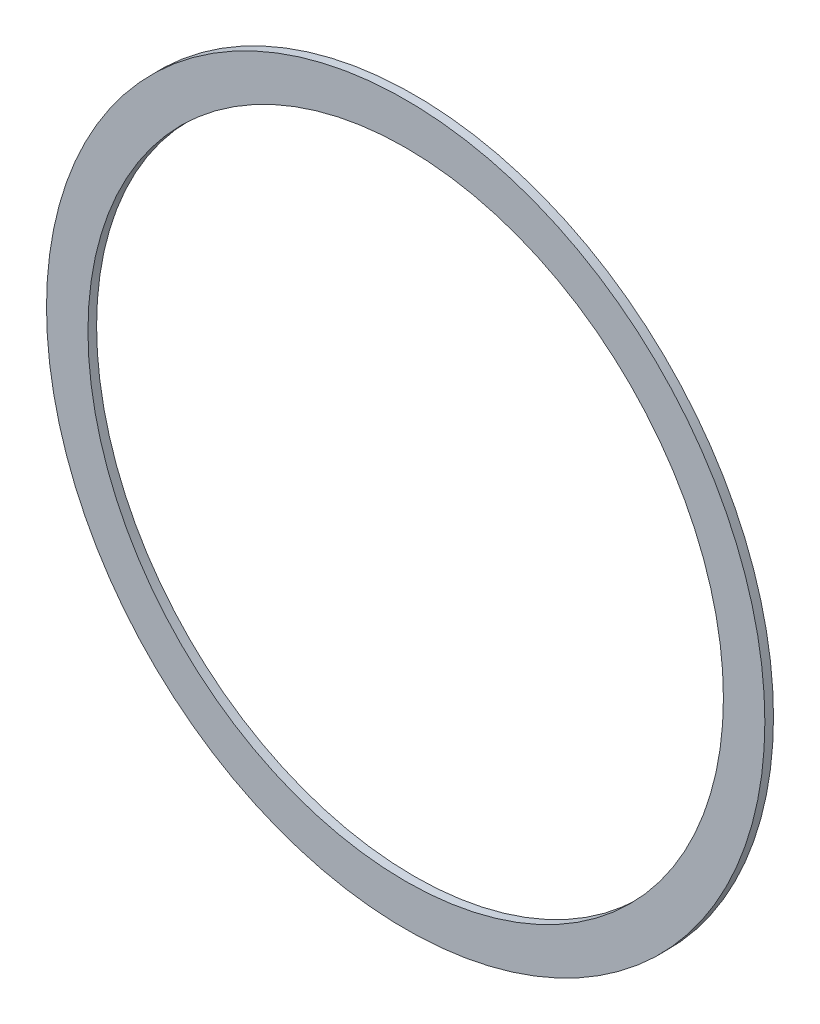
from build123d import *

# Parameters (mm, degrees)
SKETCH2_R           = 116.84
BOSS_EXTRUDE1_DEPTH = 1.5875


with BuildPart() as part:
    # Sketch2 → Boss-Extrude1 (new, symmetric)
    with BuildSketch(Plane.XY):
        with BuildLine():
            ThreePointArc((-1.651, 128.513680847), (-113.443755652, 64.087482344), (-116.974071472, -64.89271823))
            ThreePointArc((-116.974071472, -64.89271823), (-116.588202689, -65.623039511), (-116.197774242, -66.350933404))
            ThreePointArc((-116.197774242, -66.350933404), (-115.802941233, -67.076116512), (-115.403582459, -67.798817153))
            ThreePointArc((-115.403582459, -67.798817153), (0, -135.636), (115.403582459, -67.798817153))
            ThreePointArc((115.403582459, -67.798817153), (115.802941375, -67.076116254), (116.197774523, -66.350932884))
            ThreePointArc((116.197774523, -66.350932884), (116.588202828, -65.62303925), (116.974071472, -64.89271823))
            ThreePointArc((116.974071472, -64.89271823), (113.443755652, 64.087482344), (1.651, 128.513680847))
            ThreePointArc((1.651, 128.513680847), (0.825516124, 128.521420187), (0, 128.524))
            ThreePointArc((0, 128.524), (-0.825516124, 128.521420187), (-1.651, 128.513680847))
        make_face()
        with Locations((0, -3.556)):
            Circle(SKETCH2_R, mode=Mode.SUBTRACT)
    extrude(amount=BOSS_EXTRUDE1_DEPTH, both=True)


solid = part.part
